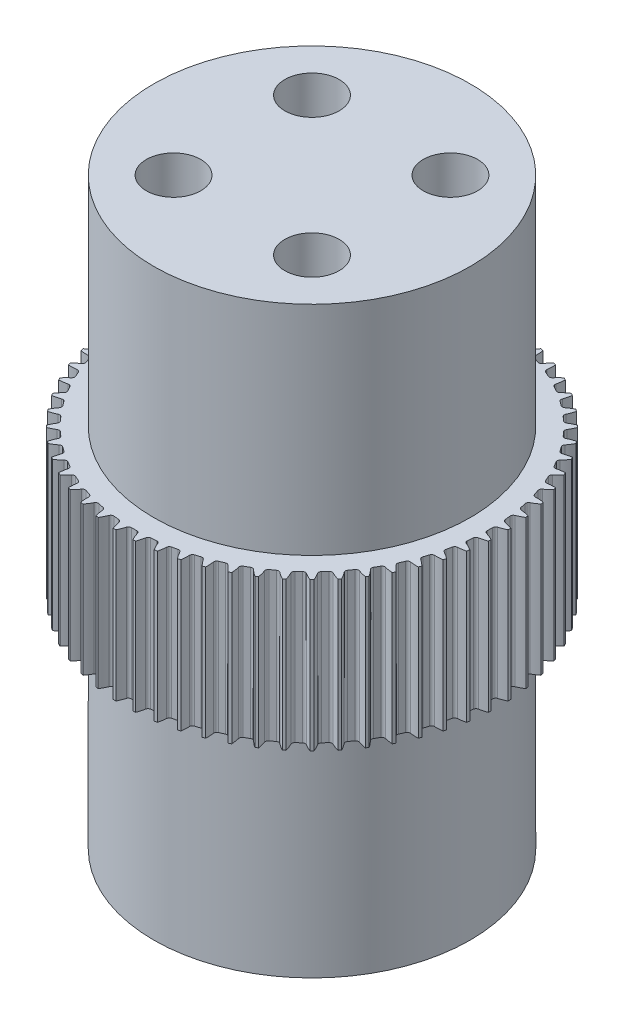
from build123d import *

# Parameters (mm, degrees)
SKETCH1_R           = 19
BOSS_EXTRUDE1_DEPTH = 15
SKETCH2_R           = 8
CUT_EXTRUDE1_DEPTH  = 31.773365107
CIRPATTERN1_COUNT   = 60
SKETCH3_R           = 8
BOSS_EXTRUDE2_DEPTH = 15
SKETCH4_R           = 16
BOSS_EXTRUDE3_DEPTH = 22
BOSS_EXTRUDE4_START = 22
SKETCH5_R           = 16
BOSS_EXTRUDE4_DEPTH = 22
SKETCH6_R           = 2.75
CUT_EXTRUDE2_DEPTH  = 125


with BuildPart() as part:
    # Sketch1 → Boss-Extrude1 (new body)
    with BuildSketch(Plane(origin=(0, 0, 0), x_dir=(1, 0, 0), z_dir=(0, 1, 0))):
        Circle(SKETCH1_R)
    extrude(amount=BOSS_EXTRUDE1_DEPTH)

    # Sketch2 → Cut-Extrude1 (cut, through all)
    with BuildSketch(Plane(origin=(0, 15, 0), x_dir=(1, 0, 0), z_dir=(0, 1, 0))):
        Circle(SKETCH2_R)
        with BuildLine():
            Line((-0.268728385, 18), (0.268728385, 18))
            ThreePointArc((0.268728385, 18), (0.449006272, 18.060208667), (0.556922217, 18.216667445))
            ThreePointArc((0.556922217, 18.216667445), (0.746491702, 18.747041733), (1, 19.25))
            ThreePointArc((1, 19.25), (0, 19.401749021), (-1, 19.25))
            ThreePointArc((-1, 19.25), (-0.746491702, 18.747041733), (-0.556922217, 18.216667445))
            ThreePointArc((-0.556922217, 18.216667445), (-0.449006272, 18.060208667), (-0.268728385, 18))
        make_face()
    cut_extrude1 = extrude(amount=-CUT_EXTRUDE1_DEPTH, mode=Mode.SUBTRACT)

    # CirPattern1: Cut-Extrude1 ×60 about axis
    cirpattern1_axis = Axis((0, 15, 0), (0, -1, 0))
    for i in range(1, CIRPATTERN1_COUNT):
        add(cut_extrude1.rotate(cirpattern1_axis, i * 360 / CIRPATTERN1_COUNT), mode=Mode.SUBTRACT)

    # Sketch3 → Boss-Extrude2 (add)
    with BuildSketch(Plane(origin=(0, 15, 0), x_dir=(1, 0, 0), z_dir=(0, 1, 0))):
        Circle(SKETCH3_R)
    extrude(amount=-BOSS_EXTRUDE2_DEPTH)

    # Sketch4 → Boss-Extrude3 (add)
    with BuildSketch(Plane(origin=(0, 15, 0), x_dir=(1, 0, 0), z_dir=(0, 1, 0))):
        Circle(SKETCH4_R)
    extrude(amount=BOSS_EXTRUDE3_DEPTH)

    # Sketch5 → Boss-Extrude4 (add)
    with BuildSketch(Plane.XZ.offset(BOSS_EXTRUDE4_START)):
        Circle(SKETCH5_R)
    extrude(amount=-BOSS_EXTRUDE4_DEPTH)

    # Sketch6 → Cut-Extrude2 (cut)
    with BuildSketch(Plane.XZ.offset(22)):
        with Locations((-7, -7)):
            Circle(SKETCH6_R)
        with Locations((7, -7)):
            Circle(SKETCH6_R)
        with Locations((-7, 7)):
            Circle(SKETCH6_R)
        with Locations((7, 7)):
            Circle(SKETCH6_R)
    extrude(amount=-CUT_EXTRUDE2_DEPTH, mode=Mode.SUBTRACT)


solid = part.part
